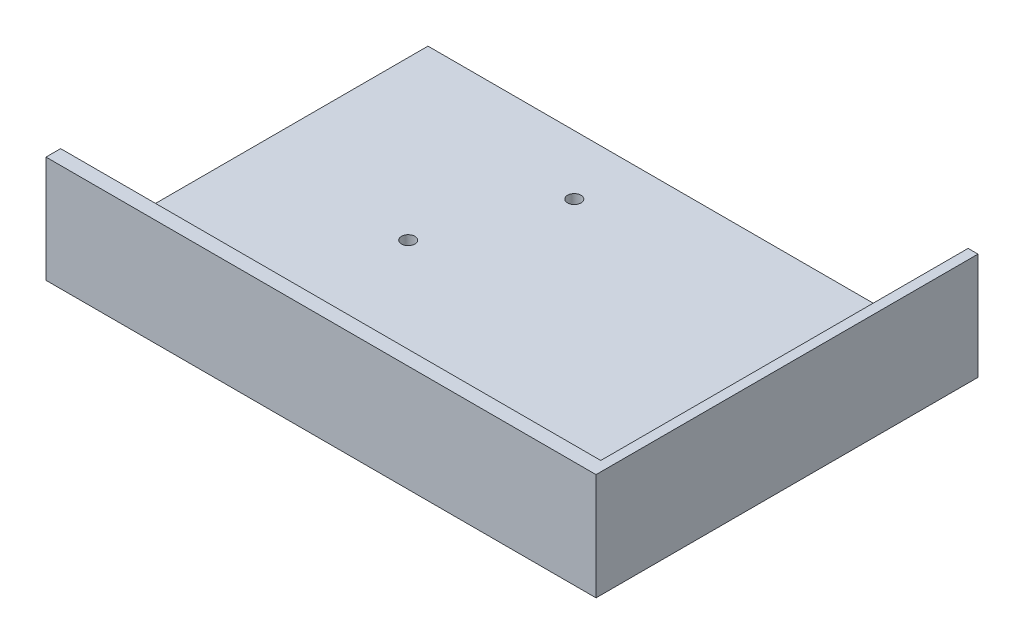
from build123d import *

# Parameters (mm, degrees)
SKETCH1_W                     = 278.2
SKETCH1_H                     = 193.2
SHELL_BLOCK_DEPTH             = 27
SKETCH2_W                     = 273.2
SKETCH2_H                     = 185.8
FRONT_OPENING_DEPTH           = 1.5
SKETCH3_W                     = 273.2
SKETCH3_H                     = 188.2
DISPLAY_POCKET_DEPTH          = 22.5
SKETCH4_W                     = 3
SKETCH4_H                     = 56
VENT_SLOTS_DEPTH              = 4
SKETCH5_W                     = 58
SKETCH5_H                     = 16
CABLE_EXIT_X_SHORT_SIDE_DEPTH = 140.1
SKETCH6_R                     = 1.7
BOLT_HOLES_DEPTH              = 4
KEEP_ONE_HALF_X_DEPTH         = 172.491603293
KEEP_ONE_HALF_X_DEPTH_BACK    = 172.491603293
SKETCH7_W                     = 200
SKETCH7_H                     = 400
KEEP_ONE_QUARTER_Z_DEPTH      = 172.491603293
KEEP_ONE_QUARTER_Z_DEPTH_BACK = 172.491603293
SKETCH8_W                     = 400
SKETCH8_H                     = 200


with BuildPart() as part:
    # Sketch1 → Shell Block (new body)
    with BuildSketch(Plane(origin=(0, 0, 0), x_dir=(1, 0, 0), z_dir=(0, 1, 0))):
        Rectangle(SKETCH1_W, SKETCH1_H)
    extrude(amount=SHELL_BLOCK_DEPTH)

    # Sketch2 → Front Opening (cut)
    with BuildSketch(Plane(origin=(0, 27, 0), x_dir=(1, 0, 0), z_dir=(0, 1, 0))):
        Rectangle(SKETCH2_W, SKETCH2_H)
    extrude(amount=-FRONT_OPENING_DEPTH, mode=Mode.SUBTRACT)

    # Sketch3 → Display Pocket (cut)
    with BuildSketch(Plane(origin=(0, 25.5, 0), x_dir=(1, 0, 0), z_dir=(0, 1, 0))):
        Rectangle(SKETCH3_W, SKETCH3_H)
    extrude(amount=-DISPLAY_POCKET_DEPTH, mode=Mode.SUBTRACT)

    # Sketch4 → Vent Slots (cut)
    with BuildSketch(Plane(origin=(0, 3, 0), x_dir=(1, 0, 0), z_dir=(0, 1, 0))):
        with Locations((-67.5, 56)):
            Rectangle(SKETCH4_W, SKETCH4_H)
        with Locations((-67.5, -56)):
            Rectangle(SKETCH4_W, SKETCH4_H)
        with Locations((-75.5, 56)):
            Rectangle(SKETCH4_W, SKETCH4_H)
        with Locations((-75.5, -56)):
            Rectangle(SKETCH4_W, SKETCH4_H)
        with Locations((-83.5, 56)):
            Rectangle(SKETCH4_W, SKETCH4_H)
        with Locations((-83.5, -56)):
            Rectangle(SKETCH4_W, SKETCH4_H)
        with Locations((-91.5, 56)):
            Rectangle(SKETCH4_W, SKETCH4_H)
        with Locations((-91.5, -56)):
            Rectangle(SKETCH4_W, SKETCH4_H)
        with Locations((-99.5, 56)):
            Rectangle(SKETCH4_W, SKETCH4_H)
        with Locations((-99.5, -56)):
            Rectangle(SKETCH4_W, SKETCH4_H)
        with Locations((-107.5, 56)):
            Rectangle(SKETCH4_W, SKETCH4_H)
        with Locations((-107.5, -56)):
            Rectangle(SKETCH4_W, SKETCH4_H)
        with Locations((-115.5, 56)):
            Rectangle(SKETCH4_W, SKETCH4_H)
        with Locations((-115.5, -56)):
            Rectangle(SKETCH4_W, SKETCH4_H)
        with Locations((-123.5, 56)):
            Rectangle(SKETCH4_W, SKETCH4_H)
        with Locations((-123.5, -56)):
            Rectangle(SKETCH4_W, SKETCH4_H)
    extrude(amount=-VENT_SLOTS_DEPTH, mode=Mode.SUBTRACT)

    # Sketch5 → Cable Exit (-X short side) (cut)
    with BuildSketch(Plane(origin=(0, 0, 0), x_dir=(0, 0, -1), z_dir=(1, 0, 0))):
        with Locations((0, 13)):
            Rectangle(SKETCH5_W, SKETCH5_H)
    extrude(amount=-CABLE_EXIT_X_SHORT_SIDE_DEPTH, mode=Mode.SUBTRACT)

    # Sketch6 → Bolt Holes (cut)
    with BuildSketch(Plane(origin=(0, 3, 0), x_dir=(1, 0, 0), z_dir=(0, 1, 0))):
        with Locations((-40, -45)):
            Circle(SKETCH6_R)
        with Locations((-40, 45)):
            Circle(SKETCH6_R)
        with Locations((40, -45)):
            Circle(SKETCH6_R)
        with Locations((40, 45)):
            Circle(SKETCH6_R)
        with Locations((-52, -15)):
            Circle(SKETCH6_R)
        with Locations((-52, 15)):
            Circle(SKETCH6_R)
        with Locations((52, -15)):
            Circle(SKETCH6_R)
        with Locations((52, 15)):
            Circle(SKETCH6_R)
        with Locations((-12, -82)):
            Circle(SKETCH6_R)
        with Locations((-12, 82)):
            Circle(SKETCH6_R)
        with Locations((12, -82)):
            Circle(SKETCH6_R)
        with Locations((12, 82)):
            Circle(SKETCH6_R)
        with Locations((-124, -12)):
            Circle(SKETCH6_R)
        with Locations((-124, 12)):
            Circle(SKETCH6_R)
        with Locations((124, -12)):
            Circle(SKETCH6_R)
        with Locations((124, 12)):
            Circle(SKETCH6_R)
        with Locations((-72, 12)):
            Circle(SKETCH6_R)
        with Locations((-72, -12)):
            Circle(SKETCH6_R)
    extrude(amount=-BOLT_HOLES_DEPTH, mode=Mode.SUBTRACT)

    # Sketch7 → Keep one half (X) (cut, two sides: drawn at the far end of the back side and taken through both)
    with BuildSketch(Plane(origin=(0, 0, 0), x_dir=(1, 0, 0), z_dir=(0, 1, 0)).offset(-KEEP_ONE_HALF_X_DEPTH_BACK)):
        with Locations((-100, 0)):
            Rectangle(SKETCH7_W, SKETCH7_H)
    extrude(amount=KEEP_ONE_HALF_X_DEPTH + KEEP_ONE_HALF_X_DEPTH_BACK, mode=Mode.SUBTRACT)

    # Sketch8 → Keep one quarter (Z) (cut, two sides: drawn at the far end of the back side and taken through both)
    with BuildSketch(Plane(origin=(0, 0, 0), x_dir=(1, 0, 0), z_dir=(0, 1, 0)).offset(-KEEP_ONE_QUARTER_Z_DEPTH_BACK)):
        with Locations((0, 100)):
            Rectangle(SKETCH8_W, SKETCH8_H)
    extrude(amount=KEEP_ONE_QUARTER_Z_DEPTH + KEEP_ONE_QUARTER_Z_DEPTH_BACK, mode=Mode.SUBTRACT)


solid = part.part
